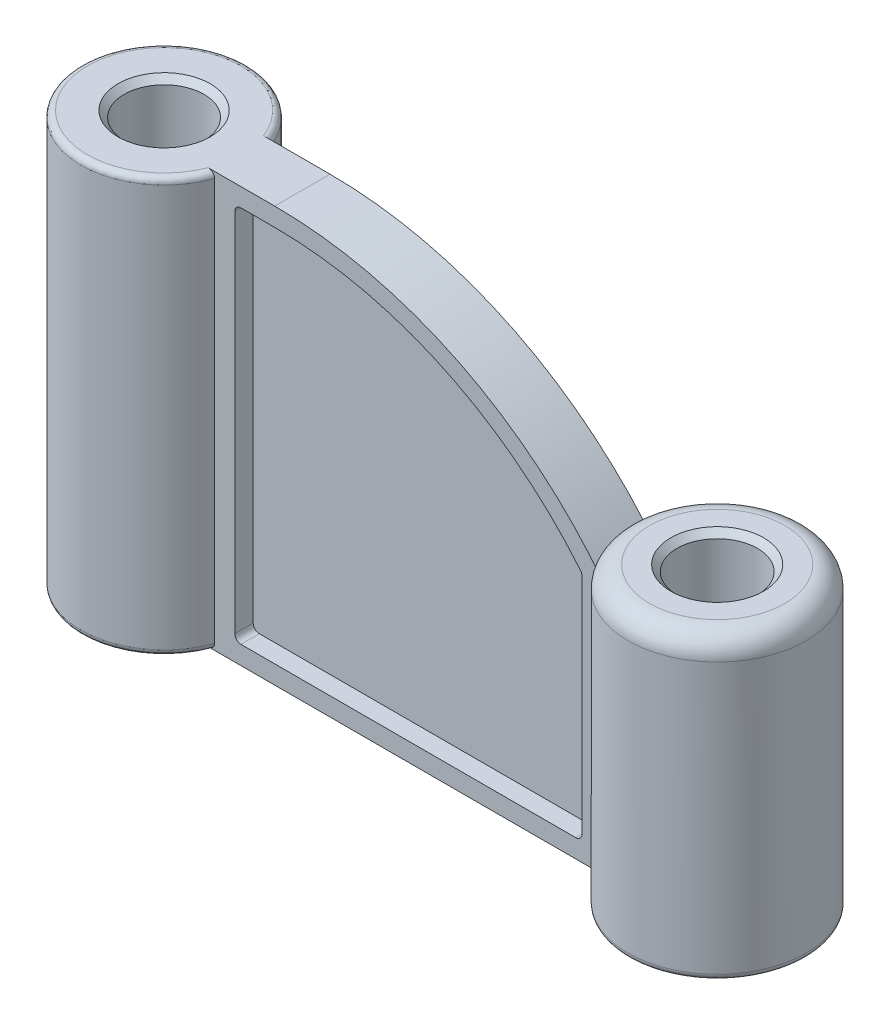
from build123d import *

# Parameters (mm, degrees)
EXTRUDE_1_DEPTH      = 9
EXTRUDE_1_DEPTH_BACK = 9
EXTRUDE_2_DEPTH      = 3
EXTRUDE_2_DEPTH_BACK = 3
SKETCH_2_R           = 13
SKETCH_2_R_2         = 13.100880905
CUT_EXTRUDE_7_DEPTH  = 183.937147832
CHAMFER_4_SIZE       = 2
CHAMFER_5_SIZE       = 2


with BuildPart() as part:
    # Эскиз1 → Повернуть1 (revolve)
    with BuildSketch(Plane.XY):
        with BuildLine():
            Line((-89, 0), (-64, 0))
            ThreePointArc((-64, 0), (-62.585786438, 0.585786438), (-62, 2))
            Line((-62, 2), (-62, 133))
            ThreePointArc((-62, 133), (-62.585786438, 134.414213562), (-64, 135))
            Line((-64, 135), (-89, 135))
            Line((-89, 135), (-89, 0))
        make_face()
    revolve(axis=Axis((-89, 135, 0), (0, -1, 0)))



with BuildPart() as body_2:
    # Эскиз1<4> → Повернуть2 (revolve)
    with BuildSketch(Plane.XY):
        with BuildLine():
            ThreePointArc((62, 2), (62.585786438, 0.585786438), (64, 0))
            Line((64, 0), (91, 0))
            Line((91, 0), (91, 97))
            Line((91, 97), (69, 97))
            ThreePointArc((69, 97), (64.050252532, 94.949747468), (62, 90))
            Line((62, 90), (62, 2))
        make_face()
    revolve(axis=Axis((91, 97, 0), (0, -1, 0)))


with BuildPart() as part_1:
    add(part.part)

    add(body_2.part)  # Бобышка-Вытянуть1 merges body 2
    # Эскиз1<5> → Бобышка-Вытянуть1 (add, two sides: drawn at the far end of the back side and taken through both)
    with BuildSketch(Plane.XY.offset(-EXTRUDE_1_DEPTH_BACK)):
        with BuildLine():
            Line((-44, 135), (-89, 135))
            Line((-89, 135), (-89, 0))
            Line((-89, 0), (-44, 0))
            Line((-44, 0), (91, 0))
            ThreePointArc((91, 0), (51.45941546, 95.45941546), (-44, 135))
        make_face()
        with BuildLine():
            Line((54, 6), (-44, 6))
            Line((-44, 6), (-55, 6))
            ThreePointArc((-55, 6), (-56.414213562, 6.585786438), (-57, 8))
            Line((-57, 8), (-57, 127))
            ThreePointArc((-57, 127), (-56.414213562, 128.414213562), (-55, 129))
            Line((-55, 129), (-44, 129))
            ThreePointArc((-44, 129), (11.03002354, 116.673461032), (55.543307087, 82.049558282))
            ThreePointArc((55.543307087, 82.049558282), (55.882367415, 81.453262691), (56, 80.777472107))
            Line((56, 80.777472107), (56, 8))
            ThreePointArc((56, 8), (55.414213562, 6.585786438), (54, 6))
        make_face(mode=Mode.SUBTRACT)
    extrude(amount=EXTRUDE_1_DEPTH + EXTRUDE_1_DEPTH_BACK)

    # Эскиз1<6> → Бобышка-Вытянуть2 (add, two sides: drawn at the far end of the back side and taken through both)
    with BuildSketch(Plane.XY.offset(-EXTRUDE_2_DEPTH_BACK)):
        with BuildLine():
            Line((-55, 6), (54, 6))
            ThreePointArc((54, 6), (55.414213562, 6.585786438), (56, 8))
            Line((56, 8), (56, 80.777472107))
            ThreePointArc((56, 80.777472107), (55.882367415, 81.453262691), (55.543307087, 82.049558282))
            ThreePointArc((55.543307087, 82.049558282), (11.03002354, 116.673461032), (-44, 129))
            Line((-44, 129), (-55, 129))
            ThreePointArc((-55, 129), (-56.414213562, 128.414213562), (-57, 127))
            Line((-57, 127), (-57, 8))
            ThreePointArc((-57, 8), (-56.414213562, 6.585786438), (-55, 6))
        make_face()
    extrude(amount=EXTRUDE_2_DEPTH + EXTRUDE_2_DEPTH_BACK)

    # Эскиз2 → Вырез-Вытянуть7 (cut, through all)
    with BuildSketch(Plane(origin=(0, 0, 0), x_dir=(1, 0, 0), z_dir=(0, 1, 0))):
        with Locations((-89, 0)):
            Circle(SKETCH_2_R)
        with Locations((91, 0)):
            Circle(SKETCH_2_R_2)
    extrude(amount=CUT_EXTRUDE_7_DEPTH, mode=Mode.SUBTRACT)

    # Фаска4
    chamfer_4_edges = [part_1.edges().sort_by_distance(p)[0] for p in [
        (77.899119095, 97, 0),
        (77.899119095, 0, 0),
    ]]
    chamfer(chamfer_4_edges, length=CHAMFER_4_SIZE)

    # Фаска5
    chamfer_5_edges = [part_1.edges().sort_by_distance(p)[0] for p in [
        (-102, 0, 0),
        (-102, 135, 0),
    ]]
    chamfer(chamfer_5_edges, length=CHAMFER_5_SIZE)


solid = part_1.part
